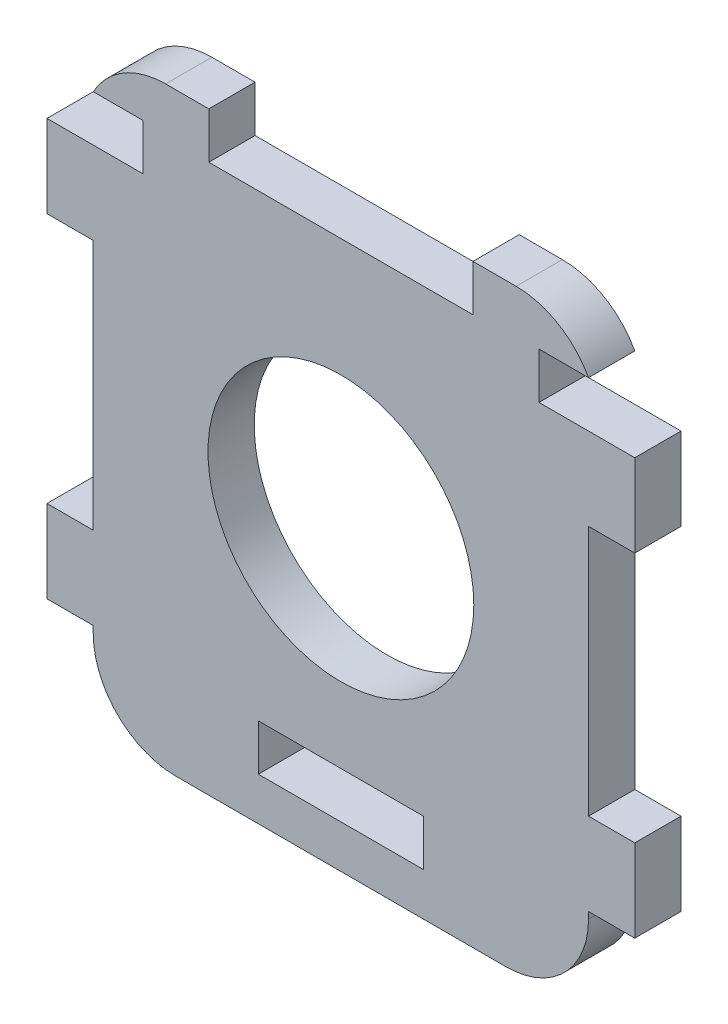
from build123d import *

# Parameters (mm, degrees)
SKETCH_1_R      = 8.05
SKETCH_1_W      = 10
SKETCH_1_H      = 2.8
EXTRUDE_1_DEPTH = 1.4
FILLET_1_R      = 5


with BuildPart() as part:
    # Эскиз1 → Бобышка-Вытянуть1 (new, symmetric)
    with BuildSketch(Plane.XY):
        Polygon((-15, 12.6), (-17.8, 12.6), (-17.8, 7.6), (-15, 7.6), (-15, -7.6), (-17.8, -7.6), (-17.8, -12.6), (-15, -12.6), (-15, -18), (15, -18), (15, -12.6), (17.8, -12.6), (17.8, -7.6), (15, -7.6), (15, 7.6), (17.8, 7.6), (17.8, 12.6), (15, 12.6), (12, 12.6), (12, 15.4), (15, 15.4), (15, 18), (8, 18), (8, 15.2), (-8, 15.2), (-8, 18), (-15, 18), (-15, 15.4), (-12, 15.4), (-12, 12.6), align=None)
        Circle(SKETCH_1_R, mode=Mode.SUBTRACT)
        with Locations((0, -14)):
            Rectangle(SKETCH_1_W, SKETCH_1_H, mode=Mode.SUBTRACT)
    extrude(amount=EXTRUDE_1_DEPTH, both=True)

    # Скругление1
    # the kernel refuses this fillet: 5 mm, written as the material it takes off along each edge
    with BuildSketch(Plane(origin=(15, 18, -12.3658561), x_dir=(-1, 0, 0), z_dir=(0, 0, 1))) as fillet_1_piece_1:
        with BuildLine():
            CenterArc((4.38634244, 5), FILLET_1_R, 208.685402014, 61.314597986)
            Line((0, 2.6), (-0.087726849, 2.552))
            ThreePointArc((-0.087726849, 2.552), (-0.1, 1.3), (-0.1, 0))
            Line((-0.1, 0), (0, -0.1))
            Line((0, -0.1), (4.38634244, -0.1))
            Line((4.38634244, -0.1), (4.38634244, 0))
        make_face()
    extrude(amount=24.731712199, mode=Mode.SUBTRACT)
    with BuildSketch(Plane(origin=(15, -18, -13.9), x_dir=(0, 1, 0), z_dir=(0, 0, 1)), Plane(origin=(-15, -18, -13.9), x_dir=(1, 0, 0), z_dir=(0, 0, 1))) as fillet_1_piece_2:
        with BuildLine():
            CenterArc((FILLET_1_R, FILLET_1_R), FILLET_1_R, 180, 90)
            Line((0, FILLET_1_R), (-FILLET_1_R * 0.02, FILLET_1_R))
            Line((-FILLET_1_R * 0.02, FILLET_1_R), (-FILLET_1_R * 0.02, -FILLET_1_R * 0.02))
            Line((-FILLET_1_R * 0.02, -FILLET_1_R * 0.02), (FILLET_1_R, -FILLET_1_R * 0.02))
            Line((FILLET_1_R, -FILLET_1_R * 0.02), (FILLET_1_R, 0))
        make_face()
    extrude(amount=27.8, mode=Mode.SUBTRACT)
    with BuildSketch(Plane(origin=(-15, 18, -12.3658561), x_dir=(0, -1, 0), z_dir=(0, 0, 1))) as fillet_1_piece_3:
        with BuildLine():
            CenterArc((5, 4.38634244), FILLET_1_R, 180, 61.314597986)
            Line((0, 4.38634244), (-0.1, 4.38634244))
            Line((-0.1, 4.38634244), (-0.1, 0))
            Line((-0.1, 0), (0, -0.1))
            ThreePointArc((0, -0.1), (1.3, -0.1), (2.552, -0.087726849))
            Line((2.552, -0.087726849), (2.6, 0))
        make_face()
    extrude(amount=24.731712199, mode=Mode.SUBTRACT)


solid = part.part
